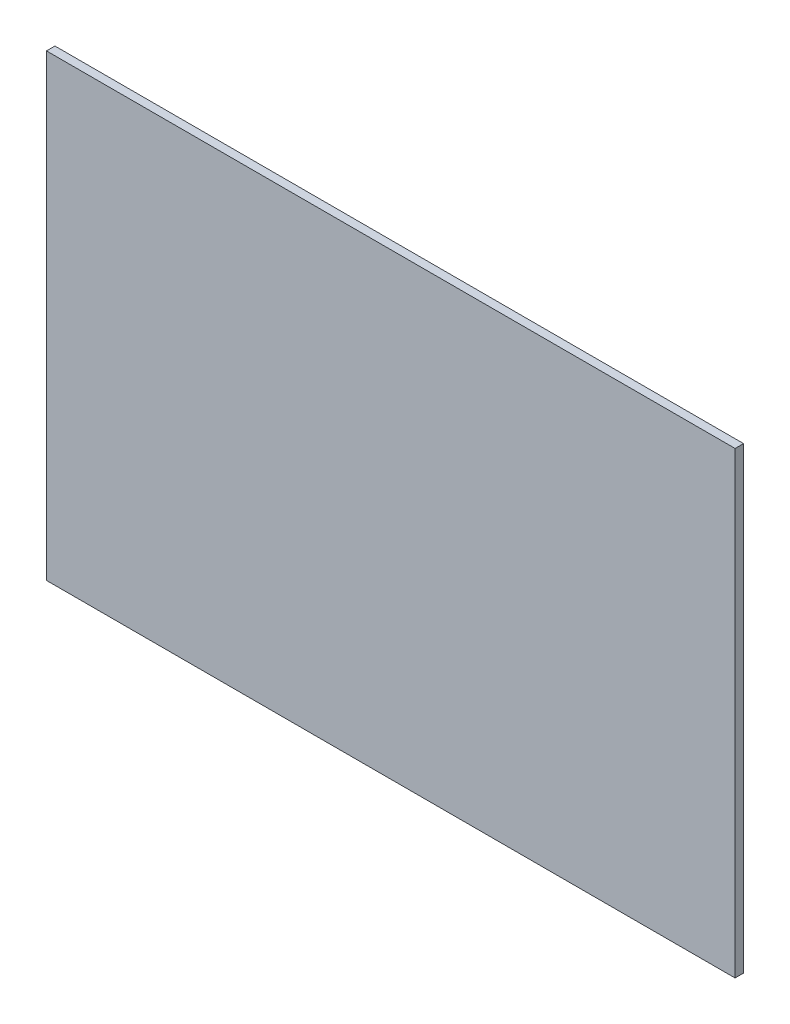
from build123d import *

# Parameters (mm, degrees)
SKETCH1_W           = 2440
SKETCH1_H           = 1625
BOSS_EXTRUDE1_DEPTH = 30


with BuildPart() as part:
    # Sketch1 → Boss-Extrude1 (new body)
    with BuildSketch(Plane.XY):
        with Locations((1220, 812.5)):
            Rectangle(SKETCH1_W, SKETCH1_H)
    extrude(amount=BOSS_EXTRUDE1_DEPTH)


solid = part.part
